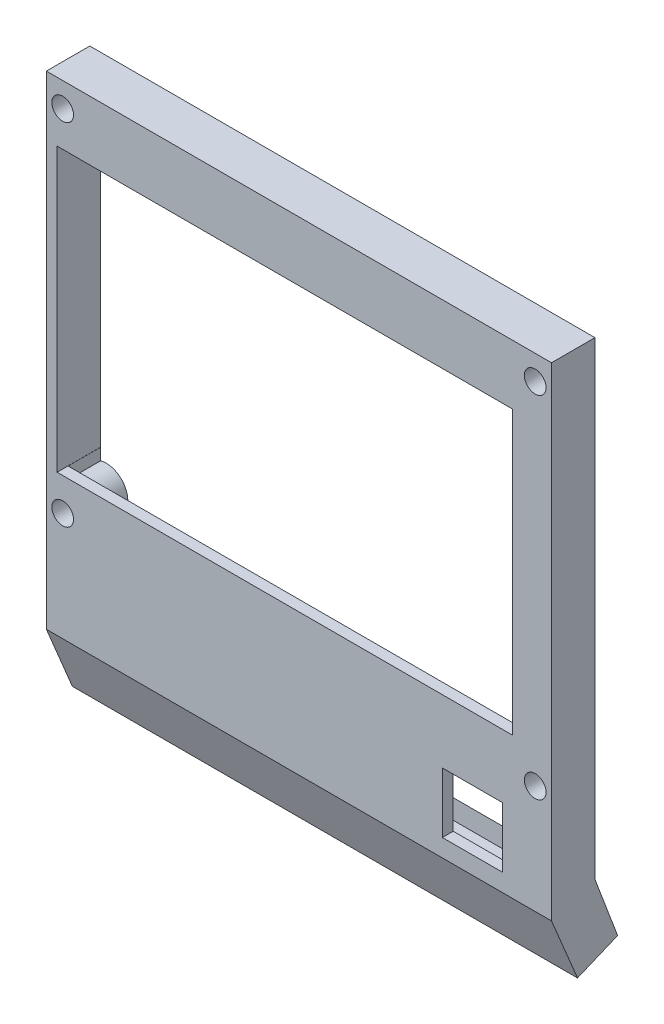
from build123d import *

# Parameters (mm, degrees)
SKETCH1_W           = 93
SKETCH1_H           = 89
BOSS_EXTRUDE1_DEPTH = 8
SKETCH2_R           = 2
SKETCH2_W           = 83.842374854
SKETCH2_H           = 52
SKETCH2_W_2         = 11.1
SKETCH2_H_2         = 11.1
CUT_EXTRUDE1_DEPTH  = 8
SHELL6_OUTLINE_W    = 11.1
SHELL6_OUTLINE_H    = 11.1
SHELL6_DEPTH        = 6
BOSS_EXTRUDE2_DEPTH = 93
SKETCH4_W           = 89
SKETCH4_H           = 6
CUT_EXTRUDE2_DEPTH  = 3


# Read off the part's stored shape, not the designer's step: Shell6
with BuildPart() as part:
    # Sketch1 → Boss-Extrude1 (new body)
    with BuildSketch(Plane.XY):
        Rectangle(SKETCH1_W, SKETCH1_H)
    extrude(amount=BOSS_EXTRUDE1_DEPTH)

    # Sketch2 → Cut-Extrude1 (cut)
    with BuildSketch(Plane.XY.offset(8)):
        with Locations((-43.5, 40)):
            Circle(SKETCH2_R)
        with Locations((43.5, 40)):
            Circle(SKETCH2_R)
        with Locations((-43.5, -24.5)):
            Circle(SKETCH2_R)
        with Locations((43.5, -24.5)):
            Circle(SKETCH2_R)
        with Locations((-2.599934873, 7.528756998)):
            Rectangle(SKETCH2_W, SKETCH2_H)
        with Locations((31.95, -35.7)):
            Rectangle(SKETCH2_W_2, SKETCH2_H_2)
    extrude(amount=-CUT_EXTRUDE1_DEPTH, mode=Mode.SUBTRACT)

    # Shell6 outline → Shell6 (cut)
    with BuildSketch(Plane.XY):
        with BuildLine():
            Line((-44.5, -18.471243002), (-44.5, -20.627016654))
            ThreePointArc((-44.5, -20.627016654), (-39.5, -24.5), (-44.5, -28.372983346))
            Line((-44.5, -28.372983346), (-44.5, -42.5))
            Line((-44.5, -42.5), (44.5, -42.5))
            Line((44.5, -42.5), (44.5, -28.372983346))
            ThreePointArc((44.5, -28.372983346), (39.5, -24.5), (44.5, -20.627016654))
            Line((44.5, -20.627016654), (44.5, 36.127016654))
            ThreePointArc((44.5, 36.127016654), (40.1414319, 37.827439226), (40.377501001, 42.5))
            Line((40.377501001, 42.5), (-40.377501001, 42.5))
            ThreePointArc((-40.377501001, 42.5), (-40.1414319, 37.827439226), (-44.5, 36.127016654))
            Line((-44.5, 36.127016654), (-44.5, 33.528756998))
            Line((-44.5, 33.528756998), (39.321252554, 33.528756998))
            Line((39.321252554, 33.528756998), (39.321252554, -18.471243002))
            Line((39.321252554, -18.471243002), (-44.5, -18.471243002))
        make_face()
        with Locations((31.95, -35.7)):
            Rectangle(SHELL6_OUTLINE_W, SHELL6_OUTLINE_H, mode=Mode.SUBTRACT)
    extrude(amount=SHELL6_DEPTH, mode=Mode.SUBTRACT)

    # Sketch3 → Boss-Extrude2 (add)
    with BuildSketch(Plane(origin=(46.5, 0, 0), x_dir=(0, 0, -1), z_dir=(1, 0, 0))):
        Polygon((-8, -44.5), (-3.210722285, -55.992973734), (4.173770218, -52.915755757), (0, -41.888855003), (0, -44.5), align=None)
    extrude(amount=-BOSS_EXTRUDE2_DEPTH)

    # Sketch4 → Cut-Extrude2 (cut)
    with BuildSketch(Plane(origin=(0, -42.5, 0), x_dir=(1, 0, 0), z_dir=(0, 1, 0))):
        with Locations((0, -3)):
            Rectangle(SKETCH4_W, SKETCH4_H)
    extrude(amount=-CUT_EXTRUDE2_DEPTH, mode=Mode.SUBTRACT)


solid = part.part
